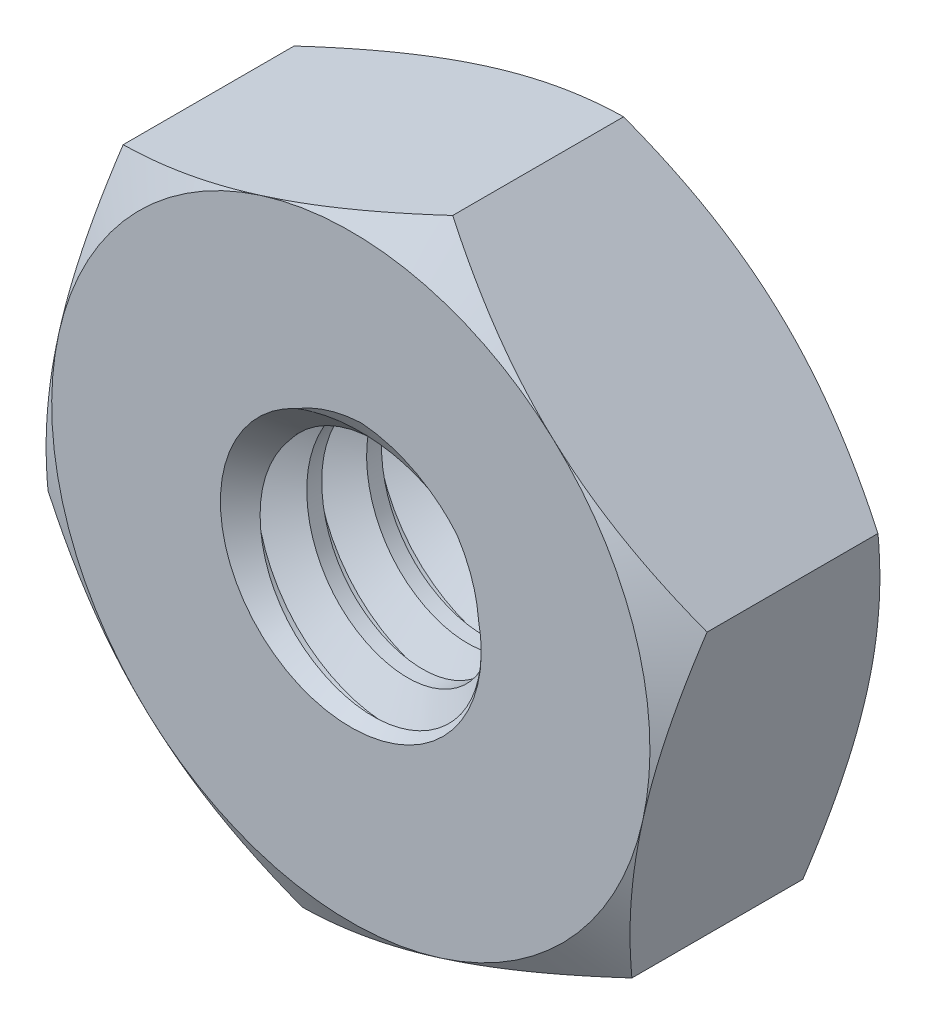
from build123d import *

# Parameters (mm, degrees)
BOSS_EXTRUDE1_DEPTH       = 2.38125
TAP_DRILL_FOR_4_40_TAP1_D = 2.2606
SKETCH13_OUTSIDE_W        = 19.302
SKETCH13_OUTSIDE_H        = 19.462
SKETCH13_OUTSIDE_R        = 3.175002494
CUT_EXTRUDE2_DEPTH        = 2.38125
CUT_EXTRUDE2_DRAFT        = -60
SKETCH14_OUTSIDE_W        = 19.302
SKETCH14_OUTSIDE_H        = 19.462
SKETCH14_OUTSIDE_R        = 3.175
CUT_EXTRUDE3_DEPTH        = 2.38125
CUT_EXTRUDE3_DRAFT        = -60
CHAMFER1_SIZE             = 0.254
THREAD1_PITCH             = 0.635


with BuildPart() as part:
    # Sketch1 → Boss-Extrude1 (new body)
    with BuildSketch(Plane.XY):
        Polygon((2.700015536, -2.48007045), (3.497811781, 1.09824682), (0.797796245, 3.57831727), (-2.700015536, 2.48007045), (-3.497811781, -1.09824682), (-0.797796245, -3.57831727), align=None)
    extrude(amount=BOSS_EXTRUDE1_DEPTH)

    # Tap Drill for #4-40 Tap1 (through all)
    with Locations(Plane(origin=(0, 0, 0), x_dir=(-1, 0, 0), z_dir=(0, 0, -1))):
        with Locations((0, 0)):
            Hole(TAP_DRILL_FOR_4_40_TAP1_D / 2)


with BuildPart() as cut_extrude2_tool:
    # Sketch13 outside → Cut-Extrude2 (with draft: the straight prism first)
    with BuildSketch(Plane(origin=(0, 0, 0), x_dir=(-1, 0, 0), z_dir=(0, 0, -1))):
        Rectangle(SKETCH13_OUTSIDE_W, SKETCH13_OUTSIDE_H)
        Circle(SKETCH13_OUTSIDE_R, mode=Mode.SUBTRACT)
    extrude(amount=-CUT_EXTRUDE2_DEPTH)
    # Cut-Extrude2: the draft: its side faces are tilted about the plane it starts from
    cut_extrude2_sides = [cut_extrude2_tool.faces().sort_by_distance(p)[0] for p in [
        (0, -9.731, 1.190625),
        (-9.651, 0, 1.190625),
        (0, 9.731, 1.190625),
        (9.651, 0, 1.190625),
        (3.175002494, 0, 1.190625),
    ]]
    draft(cut_extrude2_sides, Plane(origin=(0, 0, 0), x_dir=(-1, 0, 0), z_dir=(0, 0, -1)), CUT_EXTRUDE2_DRAFT)


with BuildPart() as part_1:
    add(part.part)

    # Cut-Extrude2: cut by cut_extrude2_tool
    add(cut_extrude2_tool.part, mode=Mode.SUBTRACT)


with BuildPart() as cut_extrude3_tool:
    # Sketch14 outside → Cut-Extrude3 (with draft: the straight prism first)
    with BuildSketch(Plane.XY.offset(2.38125)):
        Rectangle(SKETCH14_OUTSIDE_W, SKETCH14_OUTSIDE_H)
        Circle(SKETCH14_OUTSIDE_R, mode=Mode.SUBTRACT)
    extrude(amount=-CUT_EXTRUDE3_DEPTH)
    # Cut-Extrude3: the draft: its side faces are tilted about the plane it starts from
    cut_extrude3_sides = [cut_extrude3_tool.faces().sort_by_distance(p)[0] for p in [
        (0, -9.731, 1.190625),
        (9.651, 0, 1.190625),
        (0, 9.731, 1.190625),
        (-9.651, 0, 1.190625),
        (-3.175, 0, 1.190625),
    ]]
    draft(cut_extrude3_sides, Plane.XY.offset(2.38125), CUT_EXTRUDE3_DRAFT)


with BuildPart() as part_2:
    add(part_1.part)

    # Cut-Extrude3: cut by cut_extrude3_tool
    add(cut_extrude3_tool.part, mode=Mode.SUBTRACT)

    # Chamfer1
    chamfer1_edges = [part_2.edges().sort_by_distance(p)[0] for p in [
        (-1.1303, 0, 0),
        (-1.1303, 0, 2.38125),
    ]]
    chamfer(chamfer1_edges, length=CHAMFER1_SIZE)

    # Thread1: the profile of Thread Profile1 profile screwed along a right-hand helix of 4.55 turns, 6 arcs to a turn; built about Z, then put on its axis
    thread1_z = Axis((0, 0, 0), (0, 0, 1))
    thread1_corners = [(1.13, 0, -0.000173205), (1.474003831, 0, 0.198437499), (1.474003831, 0, 0.277812499), (1.13, 0, 0.476423203)]
    with BuildLine(mode=Mode.PRIVATE) as thread1_profile:
        Line(thread1_corners[0], thread1_corners[1])
        Line(thread1_corners[1], thread1_corners[2])
        Line(thread1_corners[2], thread1_corners[3])
        Line(thread1_corners[3], thread1_corners[0])
    thread1_cap = Face(thread1_profile.wire())
    thread1_turn_angles = [0, 30, 60, 90, 120, 150, 180, 210, 240, 270, 300, 330, 360]
    thread1_turn_weights = [1, 0.8660254037844387, 1, 0.8660254037844387, 1, 0.8660254037844387, 1, 0.8660254037844387, 1, 0.8660254037844387, 1, 0.8660254037844387, 1]
    thread1_turn_rails = [Edge.make_bspline([Vector(p[0], p[1], 0).rotate(thread1_z, thread1_turn_angles[k]) / thread1_turn_weights[k] + Vector(0, 0, p[2] + THREAD1_PITCH * thread1_turn_angles[k] / 360) for k in range(13)], [0, 0, 0, 1, 1, 2, 2, 3, 3, 4, 4, 5, 5, 6, 6, 6], 2, thread1_turn_weights) for p in thread1_corners]
    thread1_turn_sides = [Face.make_surface_from_curves(thread1_turn_rails[p[0]], thread1_turn_rails[p[1]]) for p in [(0, 1), (1, 2), (2, 3), (3, 0)]]
    thread1_last_angles = [1440, 1470, 1500, 1530, 1560, 1590, 1620, 1629, 1638]
    thread1_last_weights = [1, 0.8660254037844387, 1, 0.8660254037844387, 1, 0.8660254037844387, 1, 0.9876883405951364, 1]
    thread1_last_rails = [Edge.make_bspline([Vector(p[0], p[1], 0).rotate(thread1_z, thread1_last_angles[k]) / thread1_last_weights[k] + Vector(0, 0, p[2] + THREAD1_PITCH * thread1_last_angles[k] / 360) for k in range(9)], [0, 0, 0, 1, 1, 2, 2, 3, 3, 4, 4, 4], 2, thread1_last_weights) for p in thread1_corners]
    thread1_last_sides = [Face.make_surface_from_curves(thread1_last_rails[p[0]], thread1_last_rails[p[1]]) for p in [(0, 1), (1, 2), (2, 3), (3, 0)]]
    thread1 = Plane(origin=(0, 0, -0.508), x_dir=(1, 0, 0), z_dir=(0, 0, 1)) * Solid(Shell([*[p.moved(Location((0, 0, THREAD1_PITCH * i))) for i in range(4) for p in thread1_turn_sides], *thread1_last_sides, thread1_cap, thread1_cap.rotate(thread1_z, 1638).moved(Location((0, 0, THREAD1_PITCH * 1638 / 360)))]))
    add(thread1, mode=Mode.SUBTRACT)


solid = part_2.part
